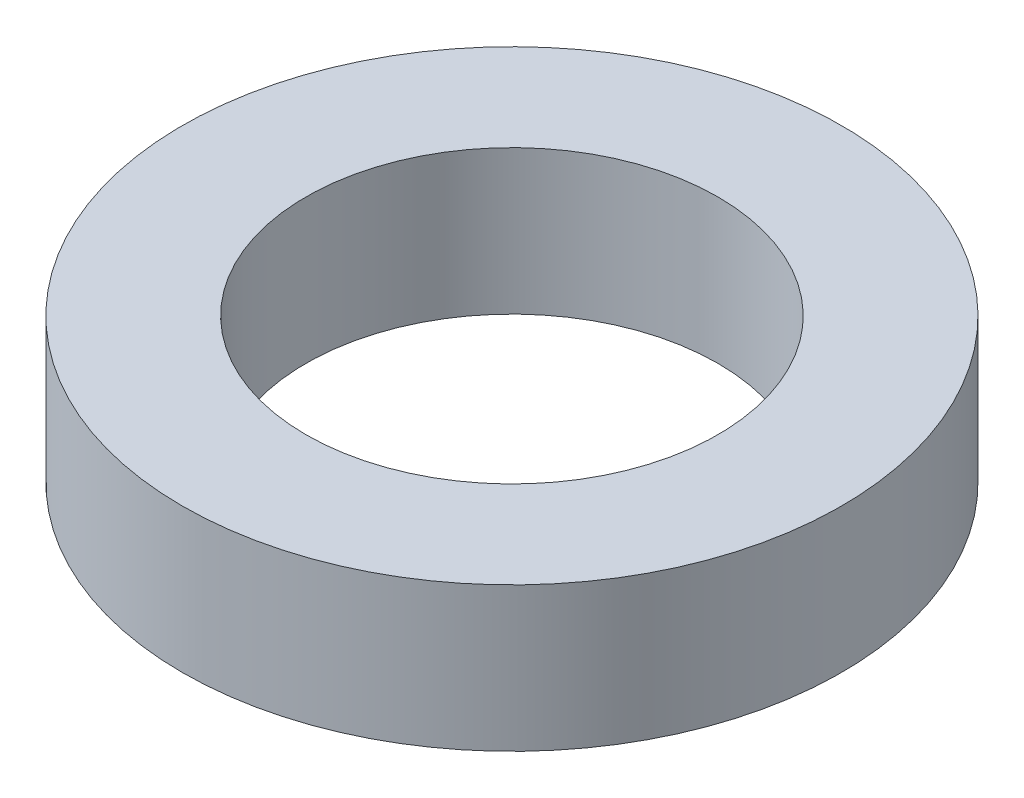
from build123d import *

# Parameters (mm, degrees)
SKETCH1_R           = 16
SKETCH1_R_2         = 10
BOSS_EXTRUDE1_DEPTH = 3.5


with BuildPart() as part:
    # Sketch1 → Boss-Extrude1 (new, symmetric)
    with BuildSketch(Plane(origin=(0, 0, 0), x_dir=(1, 0, 0), z_dir=(0, 1, 0))):
        Circle(SKETCH1_R)
        Circle(SKETCH1_R_2, mode=Mode.SUBTRACT)
    extrude(amount=BOSS_EXTRUDE1_DEPTH, both=True)


solid = part.part
